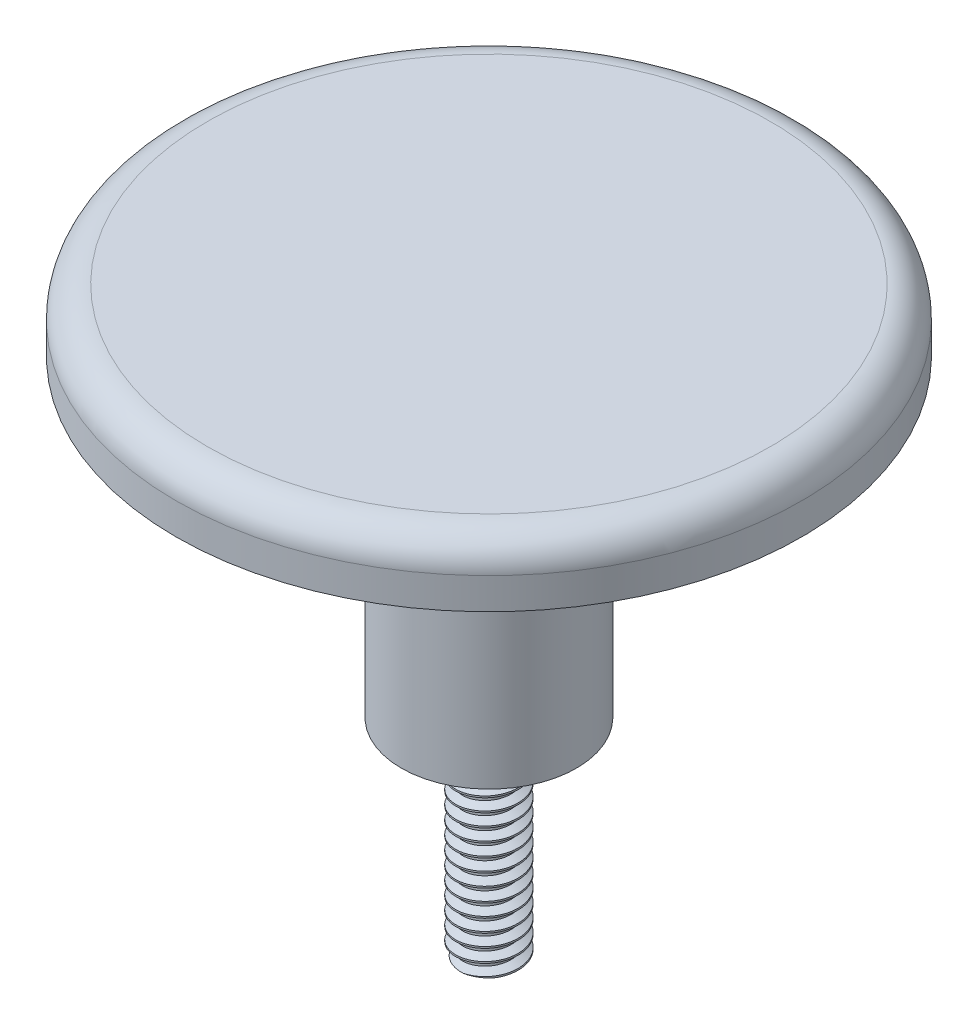
from build123d import *
from build123d.topology import SkipClean

# Parameters (mm, degrees)
SKETCH1_R           = 2.54
BOSS_EXTRUDE1_DEPTH = 16.51
SKETCH4_R           = 7.112
BOSS_EXTRUDE2_DEPTH = 25.4
THREAD2_PITCH       = 1.058333
SKETCH7_R           = 25.4
BOSS_EXTRUDE3_DEPTH = 5.08
FILLET1_R           = 2.54


with BuildPart() as part:
    # Sketch1 → Boss-Extrude1 (new body)
    with BuildSketch(Plane(origin=(0, 0, 0), x_dir=(1, 0, 0), z_dir=(0, 1, 0))):
        with Locations(Location((0, 0, 0), (0, 0, 270))):
            Circle(SKETCH1_R)
    extrude(amount=BOSS_EXTRUDE1_DEPTH)

    # Sketch4 → Boss-Extrude2 (add)
    with BuildSketch(Plane(origin=(0, 16.51, 0), x_dir=(1, 0, 0), z_dir=(0, 1, 0))):
        with Locations(Location((0, 0, 0), (0, 0, 270))):
            Circle(SKETCH4_R)
    extrude(amount=BOSS_EXTRUDE2_DEPTH)

    # Thread2: the profile of Thread Profile2 profile screwed along a right-hand helix of 15.6 turns, 8 arcs to a turn; built about Z, then put on its axis
    with SkipClean():  # the faces are left unmerged after this step: merging them gives an invalid solid
        thread2_z = Axis((0, 0, 0), (0, 0, 1))
        thread2_corners = [(2.5403, 0, -0.000173), (2.5403, 0, 0.926215), (1.96716, 0, 0.595312), (1.96716, 0, 0.330729)]
        with BuildLine(mode=Mode.PRIVATE) as thread2_profile:
            Line(thread2_corners[0], thread2_corners[1])
            Line(thread2_corners[1], thread2_corners[2])
            Line(thread2_corners[2], thread2_corners[3])
            Line(thread2_corners[3], thread2_corners[0])
        thread2_cap = Face(thread2_profile.wire())
        thread2_turn_angles = [0, 22.5, 45, 67.5, 90, 112.5, 135, 157.5, 180, 202.5, 225, 247.5, 270, 292.5, 315, 337.5, 360]
        thread2_turn_weights = [1, 0.9238795325112867, 1, 0.9238795325112867, 1, 0.9238795325112867, 1, 0.9238795325112867, 1, 0.9238795325112867, 1, 0.9238795325112867, 1, 0.9238795325112867, 1, 0.9238795325112867, 1]
        thread2_turn_rails = [Edge.make_bspline([Vector(p[0], p[1], 0).rotate(thread2_z, thread2_turn_angles[k]) / thread2_turn_weights[k] + Vector(0, 0, p[2] + THREAD2_PITCH * thread2_turn_angles[k] / 360) for k in range(17)], [0, 0, 0, 1, 1, 2, 2, 3, 3, 4, 4, 5, 5, 6, 6, 7, 7, 8, 8, 8], 2, thread2_turn_weights) for p in thread2_corners]
        thread2_turn_sides = [Face.make_surface_from_curves(thread2_turn_rails[p[0]], thread2_turn_rails[p[1]]) for p in [(0, 1), (1, 2), (2, 3), (3, 0)]]
        thread2_last_angles = [5400, 5422.5, 5445, 5467.5, 5490, 5512.5, 5535, 5557.5, 5580, 5598, 5616]
        thread2_last_weights = [1, 0.9238795325112867, 1, 0.9238795325112867, 1, 0.9238795325112867, 1, 0.9238795325112867, 1, 0.9510565162951486, 1]
        thread2_last_rails = [Edge.make_bspline([Vector(p[0], p[1], 0).rotate(thread2_z, thread2_last_angles[k]) / thread2_last_weights[k] + Vector(0, 0, p[2] + THREAD2_PITCH * thread2_last_angles[k] / 360) for k in range(11)], [0, 0, 0, 1, 1, 2, 2, 3, 3, 4, 4, 5, 5, 5], 2, thread2_last_weights) for p in thread2_corners]
        thread2_last_sides = [Face.make_surface_from_curves(thread2_last_rails[p[0]], thread2_last_rails[p[1]]) for p in [(0, 1), (1, 2), (2, 3), (3, 0)]]
        thread2 = Plane(origin=(0, 16.51, 0), x_dir=(-1, 0, 0), z_dir=(0, -1, 0)) * Solid(Shell([*[p.moved(Location((0, 0, THREAD2_PITCH * i))) for i in range(15) for p in thread2_turn_sides], *thread2_last_sides, thread2_cap, thread2_cap.rotate(thread2_z, 5616).moved(Location((0, 0, THREAD2_PITCH * 5616 / 360)))]))
        add(thread2, mode=Mode.SUBTRACT)

    # Sketch7 → Boss-Extrude3 (add)
    with SkipClean():  # the faces are left unmerged after this step: merging them gives an invalid solid
        with BuildSketch(Plane(origin=(0, 41.91, 0), x_dir=(1, 0, 0), z_dir=(0, 1, 0))):
            with Locations(Location((0, 0, 0), (0, 0, 270))):
                Circle(SKETCH7_R)
        extrude(amount=BOSS_EXTRUDE3_DEPTH)

    # Fillet1
    fillet1_edges = [part.edges().sort_by_distance(p)[0] for p in [
        (0, 46.99, -25.4),
    ]]
    fillet(fillet1_edges, radius=FILLET1_R)


solid = part.part
